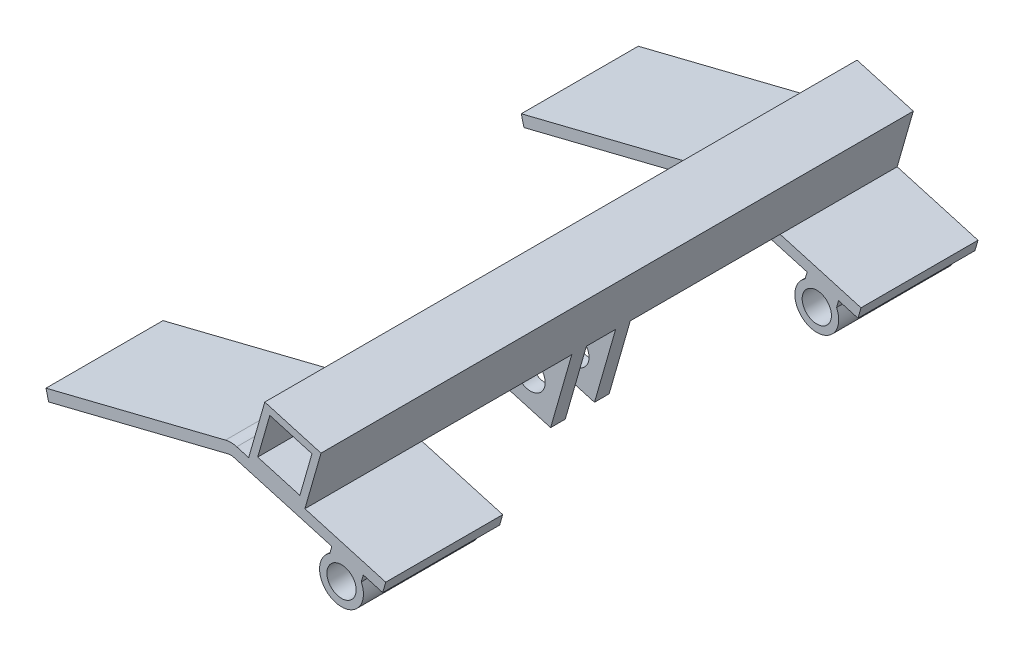
from build123d import *

# Parameters (mm, degrees)
SKETCH1_R               = 19.05
SKETCH1_R_2             = 12.7
EXTRUDE1_DEPTH          = 257.175
SKETCH2_W               = 304.8
SKETCH2_H               = 101.6
EXTRUDE2_DEPTH          = 9.525
EXTRUDE2_2_DEPTH        = 9.525
SKETCH3_W               = 50.8
SKETCH3_H               = 66.675
SKETCH3_R               = 12.7
EXTRUDE3_DEPTH          = 25.4
SKETCH4_W               = 50.8
SKETCH4_H               = 25.4
CUT_EXTRUDE1_DEPTH      = 66.675
CUT_EXTRUDE2_DEPTH      = 378.023730188
CUT_EXTRUDE2_DEPTH_BACK = 378.023730188
SKETCH5_W               = 38.1
SKETCH5_H               = 311.15
EXTRUDE4_START          = -257.175
SKETCH7_W               = 50.8
SKETCH7_H               = 50.8
SKETCH7_W_2             = 38.1
SKETCH7_H_2             = 38.1
EXTRUDE4_DEPTH          = 514.35
SKETCH9_W               = 28.398063314
SKETCH9_H               = 6.35
EXTRUDE5_DEPTH          = 101.6
SKETCH10_W              = 28.398063314
SKETCH10_H              = 6.35
EXTRUDE6_DEPTH          = 101.6
FLEX1_START             = -257.175
FLEX1_DEPTH             = 514.35
FLEX1_START_2           = -25.4
FLEX1_2_DEPTH           = 50.8
FLEX1_3_DEPTH           = 514.35
FLEX1_4_DEPTH           = 101.6
FLEX1_START_3           = 155.575
FLEX1_5_DEPTH           = 101.6
FLEX1_6_DEPTH           = 12.7
FLEX1_START_4           = 12.7
FLEX1_7_DEPTH           = 12.7


# Read off the part's stored shape, not the designer's step: Flex1
with BuildPart() as part:
    # Sketch1 → Extrude1 (new, symmetric)
    with BuildSketch(Plane.XY):
        Circle(SKETCH1_R)
        Circle(SKETCH1_R_2, mode=Mode.SUBTRACT)
    extrude(amount=EXTRUDE1_DEPTH, both=True)

    # Sketch5 → Cut-Extrude2 (cut, two sides: drawn at the far end of the back side and taken through both)
    with BuildSketch(Plane(origin=(0, 0, 0), x_dir=(1, 0, 0), z_dir=(0, 1, 0)).offset(-CUT_EXTRUDE2_DEPTH_BACK)):
        Rectangle(SKETCH5_W, SKETCH5_H)
    extrude(amount=CUT_EXTRUDE2_DEPTH + CUT_EXTRUDE2_DEPTH_BACK, mode=Mode.SUBTRACT)


with BuildPart() as body_2:
    # Sketch2 → Extrude2 (new body)
    with BuildSketch(Plane(origin=(0, 19.05, 0), x_dir=(-1, 0, 0), z_dir=(0, 1, 0))):
        with Locations((120.65, 206.375)):
            Rectangle(SKETCH2_W, SKETCH2_H)
    extrude(amount=EXTRUDE2_DEPTH)



with BuildPart() as body_3:
    # Sketch2 → Extrude2 2 (new body)
    with BuildSketch(Plane(origin=(0, 19.05, 0), x_dir=(-1, 0, 0), z_dir=(0, 1, 0))):
        with Locations((120.65, -206.375)):
            Rectangle(SKETCH2_W, SKETCH2_H)
    extrude(amount=EXTRUDE2_2_DEPTH)


with BuildPart() as body_4:
    # Sketch3 → Extrude3 (new, symmetric)
    with BuildSketch(Plane.XY):
        with Locations((-66.675, -4.7625)):
            Rectangle(SKETCH3_W, SKETCH3_H)
        with Locations((-66.675, -12.7)):
            Circle(SKETCH3_R, mode=Mode.SUBTRACT)
    extrude(amount=EXTRUDE3_DEPTH, both=True)

    # Sketch4 → Cut-Extrude1 (cut)
    with BuildSketch(Plane(origin=(0, 28.575, 0), x_dir=(-1, 0, 0), z_dir=(0, 1, 0))):
        with Locations((66.675, 0)):
            Rectangle(SKETCH4_W, SKETCH4_H)
    extrude(amount=-CUT_EXTRUDE1_DEPTH, mode=Mode.SUBTRACT)


with BuildPart() as cut_extrude1_piece_1:
    # of the separate pieces the step leaves, piece 1, a body of its own (cut_extrude1_pieces)
    add(body_4.part.solids().sort_by_distance((-92.075, 28.575, 25.4))[0])


with BuildPart() as cut_extrude1_piece_2:
    # of the separate pieces the step leaves, piece 2, a body of its own (cut_extrude1_pieces)
    add(body_4.part.solids().sort_by_distance((-92.075, 28.575, -12.7))[0])


with BuildPart() as cut_extrude2_piece_1:
    # of the separate pieces the step leaves, piece 1, a body of its own (cut_extrude2_pieces)
    add(part.part.solids().sort_by_distance((19.05, 0, 155.575))[0])


with BuildPart() as cut_extrude2_piece_2:
    # of the separate pieces the step leaves, piece 2, a body of its own (cut_extrude2_pieces)
    add(part.part.solids().sort_by_distance((19.05, 0, -257.175))[0])


with BuildPart() as body_2_1:
    add(body_2.part)

    add(body_3.part)  # Extrude4 merges body 3

    add(cut_extrude1_piece_1.part)  # Extrude4 merges Cut-Extrude1 piece 1

    add(cut_extrude1_piece_2.part)  # Extrude4 merges Cut-Extrude1 piece 2
    # Sketch7 → Extrude4 (add)
    with BuildSketch(Plane.XY.offset(EXTRUDE4_START)):
        with Locations((-66.675, 53.975)):
            Rectangle(SKETCH7_W, SKETCH7_H)
        with Locations((-66.675, 53.975)):
            Rectangle(SKETCH7_W_2, SKETCH7_H_2, mode=Mode.SUBTRACT)
    extrude(amount=EXTRUDE4_DEPTH)


    add(cut_extrude2_piece_1.part)  # Extrude5 merges Cut-Extrude2 piece 1
    # Sketch9 → Extrude5 (add)
    with BuildSketch(Plane.XY.offset(257.175)):
        with Locations((0, 15.875)):
            Rectangle(SKETCH9_W, SKETCH9_H)
    extrude(amount=-EXTRUDE5_DEPTH)


    add(cut_extrude2_piece_2.part)  # Extrude6 merges Cut-Extrude2 piece 2
    # Sketch10 → Extrude6 (add)
    with BuildSketch(Plane(origin=(0, 0, -257.175), x_dir=(-1, 0, 0), z_dir=(0, 0, -1))):
        with Locations((0, 15.875)):
            Rectangle(SKETCH10_W, SKETCH10_H)
    extrude(amount=-EXTRUDE6_DEPTH)

    # Flex1 outline → Flex1 (cut)
    with BuildSketch(Plane.XY.offset(FLEX1_START)):
        with BuildLine():
            Line((-148.464280876, 19.05), (-112.504520793, 28.015775164))
            ThreePointArc((-112.504520793, 28.015775164), (-110.244362224, 28.434670795), (-107.949999999, 28.575))
            Line((-107.949999999, 28.575), (-273.05, 28.575))
            Line((-273.05, 28.575), (-273.05, 19.05))
            Line((-273.05, 19.05), (-148.464280876, 19.05))
        make_face()
        with BuildLine():
            Line((-92.075, 28.575), (-107.949999999, 28.575))
            ThreePointArc((-107.949999999, 28.575), (-105.32987014, 28.391782672), (-102.760738129, 27.845696805))
            Line((-102.760738129, 27.845696805), (-92.383918122, 24.870191549))
            Line((-92.383918122, 24.870191549), (-85.725, 48.092598787))
            Line((-85.725, 48.092598787), (-85.725, 73.025))
            Line((-85.725, 73.025), (-78.575748996, 73.025))
            Line((-78.575748996, 73.025), (-78.381540446, 73.702285703))
            Line((-78.381540446, 73.702285703), (-76.019564503, 73.025))
            Line((-76.019564503, 73.025), (-47.625, 73.025))
            Line((-47.625, 73.025), (-47.625, 64.882989648))
            Line((-47.625, 64.882989648), (-41.275, 63.062156448))
            Line((-41.275, 63.062156448), (-41.275, 79.375))
            Line((-41.275, 79.375), (-92.075, 79.375))
            Line((-92.075, 79.375), (-92.075, 28.575))
        make_face()
        Polygon((-41.275, 41.845558685), (-41.275, 56.456255031), (-47.625, 58.277088231), (-47.625, 34.925), (-82.894846776, 34.925), (-84.529609143, 29.223906109), (-47.905538528, 18.722122852), align=None)
        Polygon((-41.275, 18.808042667), (-43.551823968, 10.867813874), (-41.275, 10.214945107), align=None)
        Polygon((-41.275, 0.30609298), (-46.177269782, 1.71179622), (-57.593118647, -38.1), (-41.275, -38.1), align=None)
        with BuildLine():
            Line((31.75, 28.575), (-38.474370052, 28.575))
            Line((-38.474370052, 28.575), (-41.205619851, 19.05))
            Line((-41.205619851, 19.05), (-14.199031657, 19.05))
            Line((-14.199031657, 19.05), (-14.199031657, 12.7))
            ThreePointArc((-14.199031657, 12.7), (-17.039583869, 8.517927071), (-18.680073508, 3.735954194))
            Line((-18.680073508, 3.735954194), (-12.545207206, 1.976809589))
            ThreePointArc((-12.545207206, 1.976809589), (3.500594419, 12.208023538), (11.68648857, -4.971517364))
            Line((11.68648857, -4.971517364), (17.821354872, -6.730661968))
            ThreePointArc((17.821354872, -6.730661968), (18.727358182, 3.49121118), (14.199031657, 12.7))
            Line((14.199031657, 12.7), (14.199031657, 19.05))
            Line((14.199031657, 19.05), (31.75, 19.05))
            Line((31.75, 19.05), (31.75, 28.575))
        make_face()
        with BuildLine():
            ThreePointArc((-2.952497042, -18.81981034), (-6.833637138, -16.268248219), (-11.372655614, -15.28284019))
            ThreePointArc((-11.372655614, -15.28284019), (-7.377671659, -17.563384096), (-2.952497042, -18.81981034))
        make_face()
        with BuildLine():
            Line((7.147791969, -13.578919183), (5.842203325, -18.13204788))
            ThreePointArc((5.842203325, -18.13204788), (8.985100393, -16.797930555), (11.839365268, -14.924206178))
            Line((11.839365268, -14.924206178), (7.147791969, -13.578919183))
        make_face()
        with BuildLine():
            ThreePointArc((-67.160894994, -25.390701559), (-76.987343342, -20.112528233), (-78.858907912, -9.116372229))
            ThreePointArc((-78.858907912, -9.116372229), (-89.657146248, -29.219602021), (-67.160894994, -25.390701559))
        make_face()
    extrude(amount=FLEX1_DEPTH, mode=Mode.SUBTRACT)

    # Flex1 2 outline → Flex1 2 (cut)
    with BuildSketch(Plane.XY.offset(FLEX1_START_2)):
        Polygon((-41.275, 10.214945107), (-43.551823968, 10.867813874), (-46.177269782, 1.71179622), (-41.275, 0.30609298), align=None)
    extrude(amount=FLEX1_2_DEPTH, mode=Mode.SUBTRACT)

    # Flex1 3 outline → Flex1 3 (add)
    with BuildSketch(Plane.XY.offset(FLEX1_START)):
        Polygon((-92.383918122, 24.870191549), (-43.551823968, 10.867813874), (-29.549446293, 59.699908027), (-41.275, 63.062156448), (-41.275, 56.456255031), (-37.403755271, 55.346193468), (-41.275, 41.845558685), (-41.275, 28.575), (-45.080271469, 28.575), (-47.905538528, 18.722122852), (-82.266604606, 28.575), (-91.321581393, 28.575), align=None)
        Polygon((-78.575748996, 73.025), (-85.725, 48.092598787), (-85.725, 34.925), (-82.894846776, 34.925), (-74.027825886, 65.847976724), (-47.625, 58.277088231), (-47.625, 64.882989648), (-76.019564503, 73.025), align=None)
    extrude(amount=FLEX1_3_DEPTH)

    # Flex1 4 outline → Flex1 4 (add)
    with BuildSketch(Plane.XY.offset(FLEX1_START)):
        with BuildLine():
            Line((-107.949999997, 19.05), (-148.464280876, 19.05))
            Line((-148.464280876, 19.05), (-268.387380698, -10.850186973))
            Line((-268.387380698, -10.850186973), (-266.083074643, -20.092253766))
            Line((-266.083074643, -20.092253766), (-110.200214738, 18.773708371))
            ThreePointArc((-110.200214738, 18.773708371), (-109.083556727, 18.9806687), (-107.949999997, 19.05))
        make_face()
        with BuildLine():
            ThreePointArc((-107.949999997, 19.05), (-106.655493926, 18.959479317), (-105.386183943, 18.689679151))
            Line((-105.386183943, 18.689679151), (-20.150178534, -5.7513521))
            Line((-20.150178534, -5.7513521), (-21.900475743, -11.85536387))
            ThreePointArc((-21.900475743, -11.85536387), (-17.002976538, -46.289206257), (5.39749476, -19.682930952))
            Line((5.39749476, -19.682930952), (5.842203325, -18.13204788))
            ThreePointArc((5.842203325, -18.13204788), (1.485212073, -18.992015299), (-2.952497042, -18.81981034))
            ThreePointArc((-2.952497042, -18.81981034), (-16.670532684, -39.686093679), (-11.372655614, -15.28284019))
            ThreePointArc((-11.372655614, -15.28284019), (-17.782583245, -6.832439764), (-18.680073508, 3.735954194))
            Line((-18.680073508, 3.735954194), (-43.551823968, 10.867813874))
            Line((-43.551823968, 10.867813874), (-72.086498047, 19.05))
            Line((-72.086498047, 19.05), (-107.949999997, 19.05))
        make_face()
        with BuildLine():
            Line((11.68648857, -4.971517364), (-12.545207206, 1.976809589))
            ThreePointArc((-12.545207206, 1.976809589), (-3.500594419, -12.208023538), (11.68648857, -4.971517364))
        make_face()
        with BuildLine():
            Line((26.644311378, -9.260604035), (17.821354872, -6.730661968))
            ThreePointArc((17.821354872, -6.730661968), (15.385809094, -11.232959473), (11.839365268, -14.924206178))
            Line((11.839365268, -14.924206178), (24.018865564, -18.416621689))
            Line((24.018865564, -18.416621689), (26.644311378, -9.260604035))
        make_face()
    extrude(amount=FLEX1_4_DEPTH)

    # Flex1 5 outline → Flex1 5 (add)
    with BuildSketch(Plane.XY.offset(FLEX1_START_3)):
        with BuildLine():
            Line((-107.949999997, 19.05), (-148.464280876, 19.05))
            Line((-148.464280876, 19.05), (-268.387380698, -10.850186973))
            Line((-268.387380698, -10.850186973), (-266.083074643, -20.092253766))
            Line((-266.083074643, -20.092253766), (-110.200214738, 18.773708371))
            ThreePointArc((-110.200214738, 18.773708371), (-109.083556727, 18.9806687), (-107.949999997, 19.05))
        make_face()
        with BuildLine():
            ThreePointArc((-107.949999997, 19.05), (-106.655493926, 18.959479317), (-105.386183943, 18.689679151))
            Line((-105.386183943, 18.689679151), (-20.150178534, -5.7513521))
            Line((-20.150178534, -5.7513521), (-21.900475743, -11.85536387))
            ThreePointArc((-21.900475743, -11.85536387), (-17.002976538, -46.289206257), (5.39749476, -19.682930952))
            Line((5.39749476, -19.682930952), (5.842203325, -18.13204788))
            ThreePointArc((5.842203325, -18.13204788), (1.485212073, -18.992015299), (-2.952497042, -18.81981034))
            ThreePointArc((-2.952497042, -18.81981034), (-16.670532684, -39.686093679), (-11.372655614, -15.28284019))
            ThreePointArc((-11.372655614, -15.28284019), (-17.782583245, -6.832439764), (-18.680073508, 3.735954194))
            Line((-18.680073508, 3.735954194), (-43.551823968, 10.867813874))
            Line((-43.551823968, 10.867813874), (-72.086498047, 19.05))
            Line((-72.086498047, 19.05), (-107.949999997, 19.05))
        make_face()
        with BuildLine():
            Line((11.68648857, -4.971517364), (-12.545207206, 1.976809589))
            ThreePointArc((-12.545207206, 1.976809589), (-3.500594419, -12.208023538), (11.68648857, -4.971517364))
        make_face()
        with BuildLine():
            Line((26.644311378, -9.260604035), (17.821354872, -6.730661968))
            ThreePointArc((17.821354872, -6.730661968), (15.385809094, -11.232959473), (11.839365268, -14.924206178))
            Line((11.839365268, -14.924206178), (24.018865564, -18.416621689))
            Line((24.018865564, -18.416621689), (26.644311378, -9.260604035))
        make_face()
    extrude(amount=FLEX1_5_DEPTH)

    # Flex1 6 outline → Flex1 6 (add)
    with BuildSketch(Plane.XY.offset(FLEX1_START_2)):
        Polygon((-92.075, 24.781610703), (-92.383918122, 24.870191549), (-110.762038821, -39.221932028), (-61.929944667, -53.224309703), (-57.593118647, -38.1), (-92.075, -38.1), align=None)
        with BuildLine():
            ThreePointArc((-78.858907912, -9.116372229), (-69.032459564, -14.394545555), (-67.160894994, -25.390701559))
            ThreePointArc((-67.160894994, -25.390701559), (-56.362656658, -5.287471767), (-78.858907912, -9.116372229))
        make_face()
    extrude(amount=FLEX1_6_DEPTH)

    # Flex1 7 outline → Flex1 7 (add)
    with BuildSketch(Plane.XY.offset(FLEX1_START_4)):
        Polygon((-92.075, 24.781610703), (-92.383918122, 24.870191549), (-110.762038821, -39.221932028), (-61.929944667, -53.224309703), (-57.593118647, -38.1), (-92.075, -38.1), align=None)
        with BuildLine():
            ThreePointArc((-78.858907912, -9.116372229), (-69.032459564, -14.394545555), (-67.160894994, -25.390701559))
            ThreePointArc((-67.160894994, -25.390701559), (-56.362656658, -5.287471767), (-78.858907912, -9.116372229))
        make_face()
    extrude(amount=FLEX1_7_DEPTH)


solid = body_2_1.part
